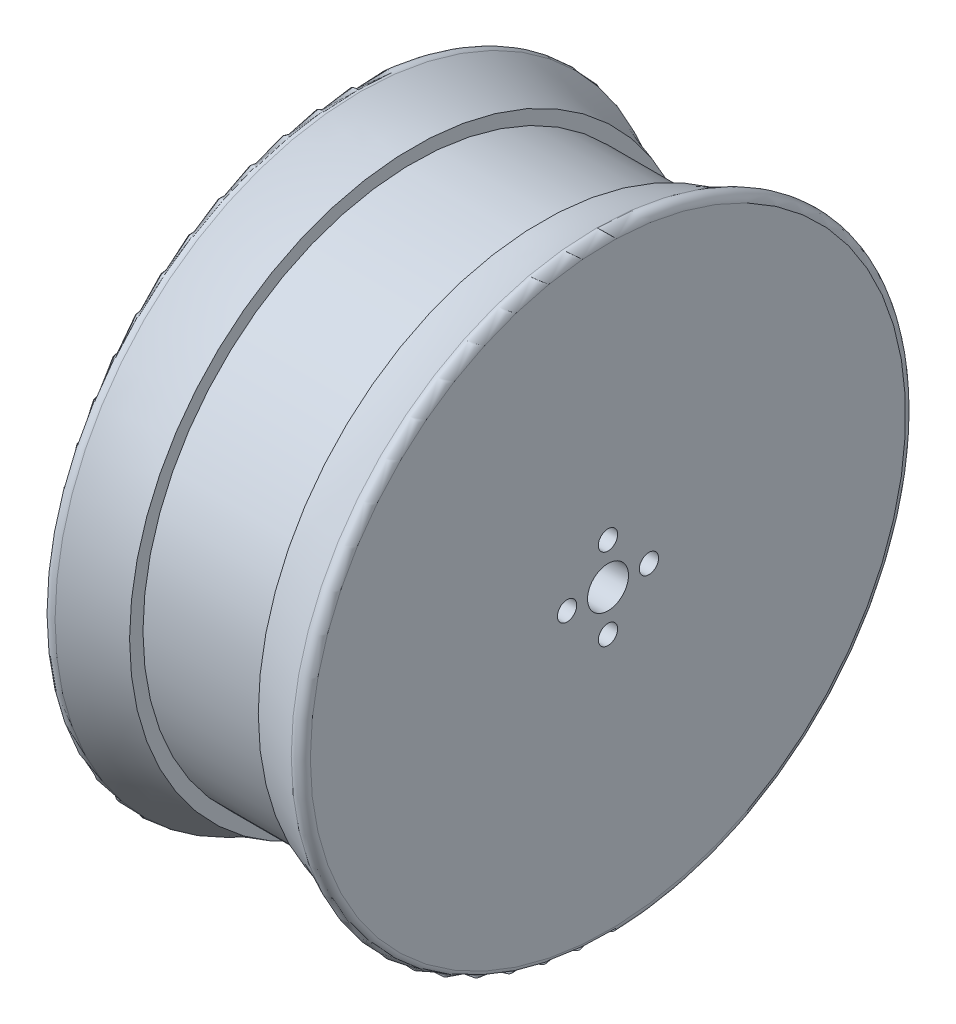
from build123d import *

# Parameters (mm, degrees)
FLOWER_R       = 4
FLOWER_R_2     = 1.885
MOUNTING_DEPTH = 99.604197228


with BuildPart() as part:
    # Wheel Arc → Wheel (revolve)
    with BuildSketch(Plane.XY):
        with BuildLine():
            Line((-25.4, 0), (25.4, 0))
            Line((25.4, 0), (25.4, -58.170962527))
            ThreePointArc((25.4, -58.170962527), (24.634795193, -59.528897306), (23.076866942, -59.577731965))
            ThreePointArc((23.076866942, -59.577731965), (17.93994263, -57.251785424), (12.573, -55.521483285))
            Line((12.573, -55.521483285), (12.573, -52.9082))
            Line((12.573, -52.9082), (-12.573, -52.9082))
            Line((-12.573, -52.9082), (-12.573, -55.521483285))
            ThreePointArc((-12.573, -55.521483285), (-17.93994263, -57.251785424), (-23.076866942, -59.577731965))
            ThreePointArc((-23.076866942, -59.577731965), (-24.634795193, -59.528897306), (-25.4, -58.170962527))
            Line((-25.4, -58.170962527), (-25.4, 0))
        make_face()
    revolve(axis=Axis((-40.905271883, 0, 0), (1, 0, 0)))

    # Flower → Mounting (cut, through all)
    with BuildSketch(Plane(origin=(25.4, 0, 0), x_dir=(0, 0, -1), z_dir=(1, 0, 0))):
        Circle(FLOWER_R)
        with Locations((0, 8)):
            Circle(FLOWER_R_2)
        with Locations((8, 0)):
            Circle(FLOWER_R_2)
        with Locations((0, -8)):
            Circle(FLOWER_R_2)
        with Locations((-8, 0)):
            Circle(FLOWER_R_2)
    extrude(amount=-MOUNTING_DEPTH, mode=Mode.SUBTRACT)


solid = part.part
